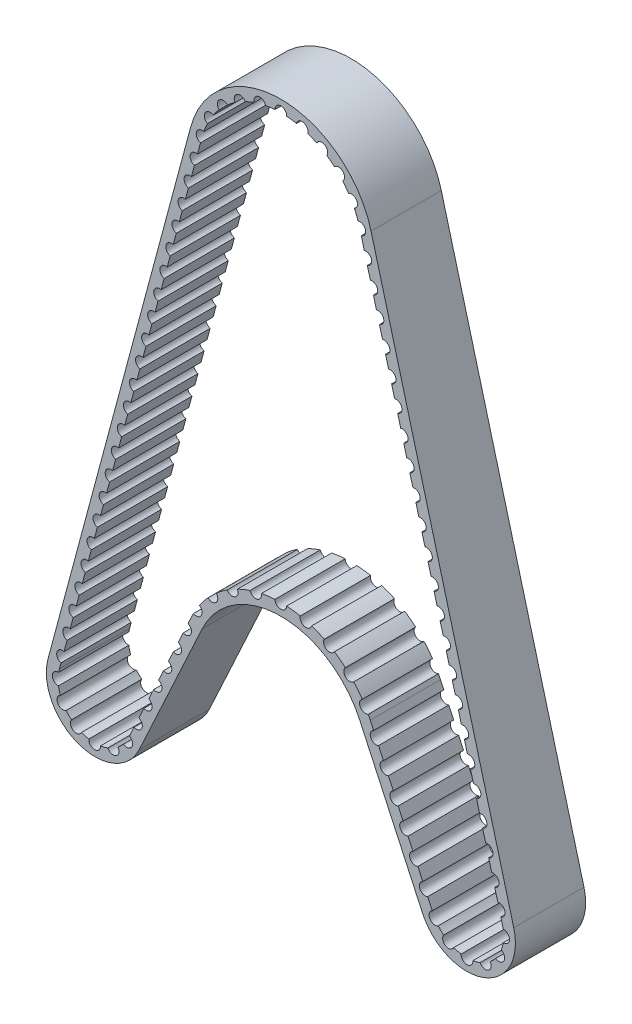
from build123d import *

# Parameters (mm, degrees)
BOSS_EXTRUDE2_DEPTH = 4.5
SKETCH5_R           = 0.75
CUT_EXTRUDE1_DEPTH  = 66.625390772
CRVPATTERN2_START   = -4.5
CRVPATTERN2_DEPTH   = 9


# Read off the part's stored shape, not the designer's step: CrvPattern2
with BuildPart() as part:
    # Sketch4 → Boss-Extrude2 (new, symmetric)
    with BuildSketch(Plane.XY):
        with BuildLine():
            Line((-11.555026183, 48.779394537), (-29.835342734, -19.379348562))
            ThreePointArc((-29.835342734, -19.379348562), (-25.936706118, -26.857426012), (-18.15277321, -23.612214415))
            Line((-18.15277321, -23.612214415), (-10.086071164, -6.170051959))
            ThreePointArc((-10.086071164, -6.170051959), (0, 0.2778125), (10.086071164, -6.170051959))
            Line((10.086071164, -6.170051959), (18.15277321, -23.612214415))
            ThreePointArc((18.15277321, -23.612214415), (25.936706118, -26.857426012), (29.835342734, -19.379348562))
            Line((29.835342734, -19.379348562), (11.555026183, 48.779394537))
            ThreePointArc((11.555026183, 48.779394537), (0, 57.6437125), (-11.555026183, 48.779394537))
        make_face()
        with BuildLine():
            Line((-10.098502161, 48.388751767), (-28.378818713, -19.769991331))
            ThreePointArc((-28.378818713, -19.769991331), (-25.423002311, -25.439620525), (-19.521483699, -22.979209205))
            Line((-19.521483699, -22.979209205), (-11.454781654, -5.53704675))
            ThreePointArc((-11.454781654, -5.53704675), (0, 1.7858125), (11.454781654, -5.53704675))
            Line((11.454781654, -5.53704675), (19.521483699, -22.979209205))
            ThreePointArc((19.521483699, -22.979209205), (25.423002311, -25.439620525), (28.378818713, -19.769991331))
            Line((28.378818713, -19.769991331), (10.098502161, 48.388751767))
            ThreePointArc((10.098502161, 48.388751767), (0, 56.1357125), (-10.098502161, 48.388751767))
        make_face(mode=Mode.SUBTRACT)
    extrude(amount=BOSS_EXTRUDE2_DEPTH, both=True)

    # Sketch5 → Cut-Extrude1 (cut, through all)
    with BuildSketch(Plane.XY.offset(4.5)):
        with Locations((0, 56.1357125)):
            Circle(SKETCH5_R)
    extrude(amount=-CUT_EXTRUDE1_DEPTH, mode=Mode.SUBTRACT)

    # CrvPattern2 outline → CrvPattern2 (cut)
    with BuildSketch(Plane.XY.offset(CRVPATTERN2_START)):
        with BuildLine():
            ThreePointArc((-3.423920652, 55.559186754), (-2.706923511, 55.779221068), (-1.975997457, 55.947289816))
            ThreePointArc((-1.975997457, 55.947289816), (-2.901099978, 56.503648773), (-3.423920652, 55.559186754))
        make_face()
        with BuildLine():
            ThreePointArc((1.994932404, 55.943627455), (2.725547197, 55.774210738), (3.442137247, 55.552854236))
            ThreePointArc((3.442137247, 55.552854236), (2.921059602, 56.498279035), (1.994932404, 55.943627455))
        make_face()
        with BuildLine():
            ThreePointArc((4.584104721, 55.077193529), (5.245945865, 54.724395712), (5.880793147, 54.325060103))
            ThreePointArc((5.880793147, 54.325060103), (5.622254701, 55.373157348), (4.584104721, 55.077193529))
        make_face()
        with BuildLine():
            ThreePointArc((6.860674161, 53.569960098), (7.408608865, 53.057839447), (7.918421374, 52.507756539))
            ThreePointArc((7.918421374, 52.507756539), (7.940052582, 53.587053557), (6.860674161, 53.569960098))
        make_face()
        with BuildLine():
            ThreePointArc((8.669395111, 51.52470961), (9.066058179, 50.88818906), (9.416070379, 50.224870539))
            ThreePointArc((9.416070379, 50.224870539), (9.716396151, 51.261767059), (8.669395111, 51.52470961))
        make_face()
        with BuildLine():
            Line((10.098502161, 48.388751767), (10.300234857, 47.636584977))
            ThreePointArc((10.300234857, 47.636584977), (10.827025773, 48.5672582), (9.887742276, 49.078538779))
            ThreePointArc((9.887742276, 49.078538779), (9.999072117, 48.735463225), (10.098502161, 48.388751767))
        make_face()
        with BuildLine():
            Line((10.688805252, 46.187787873), (11.077375646, 44.738990769))
            ThreePointArc((11.077375646, 44.738990769), (11.607489001, 45.657674518), (10.688805252, 46.187787873))
        make_face()
        with BuildLine():
            Line((11.46594604, 43.290193665), (11.854516435, 41.841396561))
            ThreePointArc((11.854516435, 41.841396561), (12.384629789, 42.76008031), (11.46594604, 43.290193665))
        make_face()
        with BuildLine():
            Line((12.243086829, 40.392599457), (12.631657223, 38.943802352))
            ThreePointArc((12.631657223, 38.943802352), (13.161770578, 39.862486101), (12.243086829, 40.392599457))
        make_face()
        with BuildLine():
            Line((13.020227618, 37.495005248), (13.408798012, 36.046208144))
            ThreePointArc((13.408798012, 36.046208144), (13.938911367, 36.964891893), (13.020227618, 37.495005248))
        make_face()
        with BuildLine():
            Line((13.797368406, 34.59741104), (14.1859388, 33.148613936))
            ThreePointArc((14.1859388, 33.148613936), (14.716052155, 34.067297685), (13.797368406, 34.59741104))
        make_face()
        with BuildLine():
            Line((14.574509195, 31.699816832), (14.963079589, 30.251019728))
            ThreePointArc((14.963079589, 30.251019728), (15.493192944, 31.169703477), (14.574509195, 31.699816832))
        make_face()
        with BuildLine():
            Line((15.351649983, 28.802222624), (15.740220378, 27.35342552))
            ThreePointArc((15.740220378, 27.35342552), (16.270333732, 28.272109269), (15.351649983, 28.802222624))
        make_face()
        with BuildLine():
            Line((16.128790772, 25.904628416), (16.517361166, 24.455831312))
            ThreePointArc((16.517361166, 24.455831312), (17.047474521, 25.374515061), (16.128790772, 25.904628416))
        make_face()
        with BuildLine():
            Line((16.905931561, 23.007034208), (17.294501955, 21.558237104))
            ThreePointArc((17.294501955, 21.558237104), (17.82461531, 22.476920853), (16.905931561, 23.007034208))
        make_face()
        with BuildLine():
            Line((17.683072349, 20.10944), (18.071642743, 18.660642896))
            ThreePointArc((18.071642743, 18.660642896), (18.601756098, 19.579326645), (17.683072349, 20.10944))
        make_face()
        with BuildLine():
            Line((18.460213138, 17.211845792), (18.848783532, 15.763048688))
            ThreePointArc((18.848783532, 15.763048688), (19.378896887, 16.681732437), (18.460213138, 17.211845792))
        make_face()
        with BuildLine():
            Line((19.237353926, 14.314251584), (19.625924321, 12.86545448))
            ThreePointArc((19.625924321, 12.86545448), (20.156037675, 13.784138229), (19.237353926, 14.314251584))
        make_face()
        with BuildLine():
            Line((20.014494715, 11.416657376), (20.403065109, 9.967860272))
            ThreePointArc((20.403065109, 9.967860272), (20.933178464, 10.886544021), (20.014494715, 11.416657376))
        make_face()
        with BuildLine():
            Line((20.791635504, 8.519063168), (21.180205898, 7.070266064))
            ThreePointArc((21.180205898, 7.070266064), (21.710319253, 7.988949813), (20.791635504, 8.519063168))
        make_face()
        with BuildLine():
            Line((21.568776292, 5.62146896), (21.957346686, 4.172671856))
            ThreePointArc((21.957346686, 4.172671856), (22.487460041, 5.091355605), (21.568776292, 5.62146896))
        make_face()
        with BuildLine():
            Line((22.345917081, 2.723874751), (22.734487475, 1.275077647))
            ThreePointArc((22.734487475, 1.275077647), (23.26460083, 2.193761396), (22.345917081, 2.723874751))
        make_face()
        with BuildLine():
            Line((23.123057869, -0.173719457), (23.511628264, -1.622516561))
            ThreePointArc((23.511628264, -1.622516561), (24.041741618, -0.703832812), (23.123057869, -0.173719457))
        make_face()
        with BuildLine():
            Line((23.900198658, -3.071313665), (24.288769052, -4.520110769))
            ThreePointArc((24.288769052, -4.520110769), (24.818882407, -3.60142702), (23.900198658, -3.071313665))
        make_face()
        with BuildLine():
            Line((24.677339447, -5.968907873), (25.065909841, -7.417704977))
            ThreePointArc((25.065909841, -7.417704977), (25.596023196, -6.499021228), (24.677339447, -5.968907873))
        make_face()
        with BuildLine():
            Line((25.454480235, -8.866502081), (25.843050629, -10.315299185))
            ThreePointArc((25.843050629, -10.315299185), (26.373163984, -9.396615436), (25.454480235, -8.866502081))
        make_face()
        with BuildLine():
            Line((26.231621024, -11.764096289), (26.620191418, -13.212893393))
            ThreePointArc((26.620191418, -13.212893393), (27.150304773, -12.294209644), (26.231621024, -11.764096289))
        make_face()
        with BuildLine():
            Line((27.008761812, -14.661690497), (27.397332207, -16.110487601))
            ThreePointArc((27.397332207, -16.110487601), (27.927445561, -15.191803852), (27.008761812, -14.661690497))
        make_face()
        with BuildLine():
            Line((27.785902601, -17.559284705), (28.174472995, -19.008081809))
            ThreePointArc((28.174472995, -19.008081809), (28.70458635, -18.08939806), (27.785902601, -17.559284705))
        make_face()
        with BuildLine():
            ThreePointArc((28.475416545, -20.214715326), (28.540086458, -20.961921992), (28.485779598, -21.709953251))
            ThreePointArc((28.485779598, -21.709953251), (29.290068445, -20.956724088), (28.475416545, -20.214715326))
        make_face()
        with BuildLine():
            ThreePointArc((28.240405917, -22.651430232), (27.922691736, -23.330810611), (27.501538441, -23.951398963))
            ThreePointArc((27.501538441, -23.951398963), (28.574730528, -23.70141203), (28.240405917, -22.651430232))
        make_face()
        with BuildLine():
            ThreePointArc((26.818181209, -24.643937801), (26.203268742, -25.073335819), (25.528189009, -25.400088562))
            ThreePointArc((25.528189009, -25.400088562), (26.582539118, -25.72037058), (26.818181209, -24.643937801))
        make_face()
        with BuildLine():
            ThreePointArc((24.590070576, -25.658005127), (23.842830703, -25.722290205), (23.094827512, -25.667598102))
            ThreePointArc((23.094827512, -25.667598102), (23.847642351, -26.47227477), (24.590070576, -25.658005127))
        make_face()
        with BuildLine():
            ThreePointArc((22.153477028, -25.421739574), (21.474260369, -25.103675541), (20.853889002, -24.682202687))
            ThreePointArc((20.853889002, -24.682202687), (21.103323185, -25.75552338), (22.153477028, -25.421739574))
        make_face()
        with BuildLine():
            Line((19.521483699, -22.979209205), (19.397974946, -22.712153384))
            ThreePointArc((19.397974946, -22.712153384), (19.08772229, -23.766246638), (20.161702198, -23.998488874))
            ThreePointArc((20.161702198, -23.998488874), (19.809022065, -23.509307097), (19.521483699, -22.979209205))
        make_face()
        with BuildLine():
            Line((18.80899043, -21.438626291), (18.179343338, -20.077176865))
            ThreePointArc((18.179343338, -20.077176865), (17.813442171, -21.072725124), (18.80899043, -21.438626291))
        make_face()
        with BuildLine():
            Line((17.549696246, -18.715727439), (16.920049154, -17.354278013))
            ThreePointArc((16.920049154, -17.354278013), (16.554147987, -18.349826272), (17.549696246, -18.715727439))
        make_face()
        with BuildLine():
            Line((16.290402062, -15.992828587), (15.66075497, -14.631379161))
            ThreePointArc((15.66075497, -14.631379161), (15.294853803, -15.62692742), (16.290402062, -15.992828587))
        make_face()
        with BuildLine():
            Line((15.031107878, -13.269929735), (14.401460786, -11.908480309))
            ThreePointArc((14.401460786, -11.908480309), (14.035559619, -12.904028568), (15.031107878, -13.269929735))
        make_face()
        with BuildLine():
            Line((13.771813694, -10.547030883), (13.142166602, -9.185581457))
            ThreePointArc((13.142166602, -9.185581457), (12.776265435, -10.181129716), (13.771813694, -10.547030883))
        make_face()
        with BuildLine():
            Line((12.512519509, -7.824132031), (11.882872417, -6.462682605))
            ThreePointArc((11.882872417, -6.462682605), (11.51697125, -7.458230864), (12.512519509, -7.824132031))
        make_face()
        with BuildLine():
            ThreePointArc((11.196580718, -5.011149015), (10.830886564, -4.356345391), (10.426942237, -3.724420569))
            ThreePointArc((10.426942237, -3.724420569), (10.187238141, -4.741334621), (11.196580718, -5.011149015))
        make_face()
        with BuildLine():
            ThreePointArc((9.338742801, -2.345582532), (8.8179922, -1.805842955), (8.266100128, -1.29798949))
            ThreePointArc((8.266100128, -1.29798949), (8.293964296, -2.342401206), (9.338742801, -2.345582532))
        make_face()
        with BuildLine():
            ThreePointArc((6.861937379, -0.242669956), (6.220645436, 0.146231888), (5.557384769, 0.496353705))
            ThreePointArc((5.557384769, 0.496353705), (5.850970378, -0.506332554), (6.861937379, -0.242669956))
        make_face()
        with BuildLine():
            ThreePointArc((3.930325958, 1.158208652), (3.210997204, 1.37049653), (2.480328547, 1.539680789))
            ThreePointArc((2.480328547, 1.539680789), (3.02017688, 0.645177563), (3.930325958, 1.158208652))
        make_face()
        with BuildLine():
            ThreePointArc((0.738214371, 1.764203713), (-0.011474421, 1.785807284), (-0.761122691, 1.762840531))
            ThreePointArc((-0.761122691, 1.762840531), (-0.010792529, 1.035807594), (0.738214371, 1.764203713))
        make_face()
        with BuildLine():
            ThreePointArc((-2.502825719, 1.535150157), (-3.233185527, 1.364637547), (-3.952127073, 1.151042008))
            ThreePointArc((-3.952127073, 1.151042008), (-3.041046615, 0.639666762), (-2.502825719, 1.535150157))
        make_face()
        with BuildLine():
            ThreePointArc((-5.577979691, 0.486229548), (-6.240602609, 0.134902252), (-6.881186321, -0.25516506))
            ThreePointArc((-6.881186321, -0.25516506), (-5.869741553, -0.516988902), (-5.577979691, 0.486229548))
        make_face()
        with BuildLine():
            ThreePointArc((-8.283427779, -1.313036147), (-8.834395469, -1.82189232), (-9.354163759, -2.362577927))
            ThreePointArc((-9.354163759, -2.362577927), (-8.309392767, -2.357496804), (-8.283427779, -1.313036147))
        make_face()
        with BuildLine():
            ThreePointArc((-10.439854148, -3.743392441), (-10.84264873, -4.376050741), (-11.207151598, -5.031518253))
            ThreePointArc((-11.207151598, -5.031518253), (-10.198301315, -4.759868939), (-10.439854148, -3.743392441))
        make_face()
        with BuildLine():
            Line((-11.891742242, -6.481861314), (-12.521389334, -7.84331074))
            ThreePointArc((-12.521389334, -7.84331074), (-11.525841075, -7.477409573), (-11.891742242, -6.481861314))
        make_face()
        with BuildLine():
            Line((-13.151036426, -9.204760165), (-13.780683519, -10.566209591))
            ThreePointArc((-13.780683519, -10.566209591), (-12.78513526, -10.200308424), (-13.151036426, -9.204760165))
        make_face()
        with BuildLine():
            Line((-14.410330611, -11.927659017), (-15.039977703, -13.289108443))
            ThreePointArc((-15.039977703, -13.289108443), (-14.044429444, -12.923207276), (-14.410330611, -11.927659017))
        make_face()
        with BuildLine():
            Line((-15.669624795, -14.650557869), (-16.299271887, -16.012007295))
            ThreePointArc((-16.299271887, -16.012007295), (-15.303723628, -15.646106128), (-15.669624795, -14.650557869))
        make_face()
        with BuildLine():
            Line((-16.928918979, -17.373456721), (-17.558566071, -18.734906147))
            ThreePointArc((-17.558566071, -18.734906147), (-16.563017812, -18.36900498), (-16.928918979, -17.373456721))
        make_face()
        with BuildLine():
            Line((-18.188213163, -20.096355573), (-18.817860255, -21.457804999))
            ThreePointArc((-18.817860255, -21.457804999), (-17.822311996, -21.091903832), (-18.188213163, -20.096355573))
        make_face()
        with BuildLine():
            ThreePointArc((-19.521483699, -22.979209205), (-19.813667305, -23.516687573), (-20.172808554, -24.011936822))
            ThreePointArc((-20.172808554, -24.011936822), (-19.097708657, -23.783206068), (-19.405282721, -22.727954561))
            Line((-19.405282721, -22.727954561), (-19.521483699, -22.979209205))
        make_face()
        with BuildLine():
            ThreePointArc((-20.86751298, -24.693092391), (-21.489435007, -25.112273726), (-22.169820435, -25.427829855))
            ThreePointArc((-22.169820435, -25.427829855), (-21.120905121, -25.765485578), (-20.86751298, -24.693092391))
        make_face()
        with BuildLine():
            ThreePointArc((-23.112071525, -25.670213913), (-23.860271394, -25.722146139), (-24.607269024, -25.655104808))
            ThreePointArc((-24.607269024, -25.655104808), (-23.867849824, -26.47210785), (-23.112071525, -25.670213913))
        make_face()
        with BuildLine():
            ThreePointArc((-25.544429577, -25.393729126), (-26.218299272, -25.064488128), (-26.831623435, -24.63282452))
            ThreePointArc((-26.831623435, -24.63282452), (-26.599954083, -25.710119296), (-25.544429577, -25.393729126))
        make_face()
        with BuildLine():
            ThreePointArc((-27.512421128, -23.937769378), (-27.931282105, -23.315631546), (-28.246487779, -22.635083691))
            ThreePointArc((-28.246487779, -22.635083691), (-28.58468367, -23.683824966), (-27.512421128, -23.937769378))
        make_face()
        with BuildLine():
            ThreePointArc((-28.488386528, -21.692707893), (-28.539933409, -20.944481377), (-28.472507369, -20.197518374))
            ThreePointArc((-28.472507369, -20.197518374), (-29.289891117, -20.936516703), (-28.488386528, -21.692707893))
        make_face()
        with BuildLine():
            Line((-28.168999213, -18.987672636), (-27.780428818, -17.538875532))
            ThreePointArc((-27.780428818, -17.538875532), (-28.699112567, -18.068988887), (-28.168999213, -18.987672636))
        make_face()
        with BuildLine():
            Line((-27.391858424, -16.090078428), (-27.00328803, -14.641281324))
            ThreePointArc((-27.00328803, -14.641281324), (-27.921971779, -15.171394679), (-27.391858424, -16.090078428))
        make_face()
        with BuildLine():
            Line((-26.614717635, -13.19248422), (-26.226147241, -11.743687116))
            ThreePointArc((-26.226147241, -11.743687116), (-27.14483099, -12.273800471), (-26.614717635, -13.19248422))
        make_face()
        with BuildLine():
            Line((-25.837576847, -10.294890012), (-25.449006452, -8.846092907))
            ThreePointArc((-25.449006452, -8.846092907), (-26.367690202, -9.376206262), (-25.837576847, -10.294890012))
        make_face()
        with BuildLine():
            Line((-25.060436058, -7.397295803), (-24.671865664, -5.948498699))
            ThreePointArc((-24.671865664, -5.948498699), (-25.590549413, -6.478612054), (-25.060436058, -7.397295803))
        make_face()
        with BuildLine():
            Line((-24.28329527, -4.499701595), (-23.894724875, -3.050904491))
            ThreePointArc((-23.894724875, -3.050904491), (-24.813408624, -3.581017846), (-24.28329527, -4.499701595))
        make_face()
        with BuildLine():
            Line((-23.506154481, -1.602107387), (-23.117584087, -0.153310283))
            ThreePointArc((-23.117584087, -0.153310283), (-24.036267836, -0.683423638), (-23.506154481, -1.602107387))
        make_face()
        with BuildLine():
            Line((-22.729013692, 1.295486821), (-22.340443298, 2.744283925))
            ThreePointArc((-22.340443298, 2.744283925), (-23.259127047, 2.21417057), (-22.729013692, 1.295486821))
        make_face()
        with BuildLine():
            Line((-21.951872904, 4.193081029), (-21.563302509, 5.641878133))
            ThreePointArc((-21.563302509, 5.641878133), (-22.481986259, 5.111764779), (-21.951872904, 4.193081029))
        make_face()
        with BuildLine():
            Line((-21.174732115, 7.090675237), (-20.786161721, 8.539472341))
            ThreePointArc((-20.786161721, 8.539472341), (-21.70484547, 8.009358986), (-21.174732115, 7.090675237))
        make_face()
        with BuildLine():
            Line((-20.397591327, 9.988269445), (-20.009020932, 11.437066549))
            ThreePointArc((-20.009020932, 11.437066549), (-20.927704681, 10.906953194), (-20.397591327, 9.988269445))
        make_face()
        with BuildLine():
            Line((-19.620450538, 12.885863653), (-19.231880144, 14.334660757))
            ThreePointArc((-19.231880144, 14.334660757), (-20.150563893, 13.804547402), (-19.620450538, 12.885863653))
        make_face()
        with BuildLine():
            Line((-18.843309749, 15.783457861), (-18.454739355, 17.232254965))
            ThreePointArc((-18.454739355, 17.232254965), (-19.373423104, 16.70214161), (-18.843309749, 15.783457861))
        make_face()
        with BuildLine():
            Line((-18.066168961, 18.681052069), (-17.677598566, 20.129849173))
            ThreePointArc((-17.677598566, 20.129849173), (-18.596282316, 19.599735819), (-18.066168961, 18.681052069))
        make_face()
        with BuildLine():
            Line((-17.289028172, 21.578646277), (-16.900457778, 23.027443381))
            ThreePointArc((-16.900457778, 23.027443381), (-17.819141527, 22.497330026), (-17.289028172, 21.578646277))
        make_face()
        with BuildLine():
            Line((-16.511887384, 24.476240485), (-16.123316989, 25.925037589))
            ThreePointArc((-16.123316989, 25.925037589), (-17.042000738, 25.394924234), (-16.511887384, 24.476240485))
        make_face()
        with BuildLine():
            Line((-15.734746595, 27.373834694), (-15.346176201, 28.822631798))
            ThreePointArc((-15.346176201, 28.822631798), (-16.26485995, 28.292518443), (-15.734746595, 27.373834694))
        make_face()
        with BuildLine():
            Line((-14.957605806, 30.271428902), (-14.569035412, 31.720226006))
            ThreePointArc((-14.569035412, 31.720226006), (-15.487719161, 31.190112651), (-14.957605806, 30.271428902))
        make_face()
        with BuildLine():
            Line((-14.180465018, 33.16902311), (-13.791894623, 34.617820214))
            ThreePointArc((-13.791894623, 34.617820214), (-14.710578373, 34.08770686), (-14.180465018, 33.16902311))
        make_face()
        with BuildLine():
            Line((-13.403324229, 36.066617318), (-13.014753835, 37.515414422))
            ThreePointArc((-13.014753835, 37.515414422), (-13.933437584, 36.985301067), (-13.403324229, 36.066617318))
        make_face()
        with BuildLine():
            Line((-12.626183441, 38.964211526), (-12.237613046, 40.41300863))
            ThreePointArc((-12.237613046, 40.41300863), (-13.156296795, 39.882895275), (-12.626183441, 38.964211526))
        make_face()
        with BuildLine():
            Line((-11.849042652, 41.861805734), (-11.460472258, 43.310602838))
            ThreePointArc((-11.460472258, 43.310602838), (-12.379156007, 42.780489483), (-11.849042652, 41.861805734))
        make_face()
        with BuildLine():
            Line((-11.071901863, 44.759399942), (-10.683331469, 46.208197046))
            ThreePointArc((-10.683331469, 46.208197046), (-11.602015218, 45.678083691), (-11.071901863, 44.759399942))
        make_face()
        with BuildLine():
            ThreePointArc((-10.098502161, 48.388751767), (-9.995979585, 48.745566373), (-9.88085383, 49.098516231))
            ThreePointArc((-9.88085383, 49.098516231), (-10.821348243, 48.588378289), (-10.294761075, 47.65699415))
            Line((-10.294761075, 47.65699415), (-10.098502161, 48.388751767))
        make_face()
        with BuildLine():
            ThreePointArc((-9.407671538, 50.242231547), (-9.056436386, 50.904903312), (-8.658599877, 51.5406911))
            ThreePointArc((-8.658599877, 51.5406911), (-9.706084155, 51.27968028), (-9.407671538, 50.242231547))
        make_face()
        with BuildLine():
            ThreePointArc((-7.905814104, 52.522351123), (-7.394987788, 53.071492703), (-6.846109366, 53.58260177))
            ThreePointArc((-6.846109366, 53.58260177), (-7.925454421, 53.601686206), (-7.905814104, 52.522351123))
        make_face()
        with BuildLine():
            ThreePointArc((-5.864837173, 54.335893018), (-5.229254363, 54.734056917), (-4.566763579, 55.085633312))
            ThreePointArc((-4.566763579, 55.085633312), (-5.604365863, 55.383511583), (-5.864837173, 54.335893018))
        make_face()
    extrude(amount=CRVPATTERN2_DEPTH, mode=Mode.SUBTRACT)


solid = part.part
